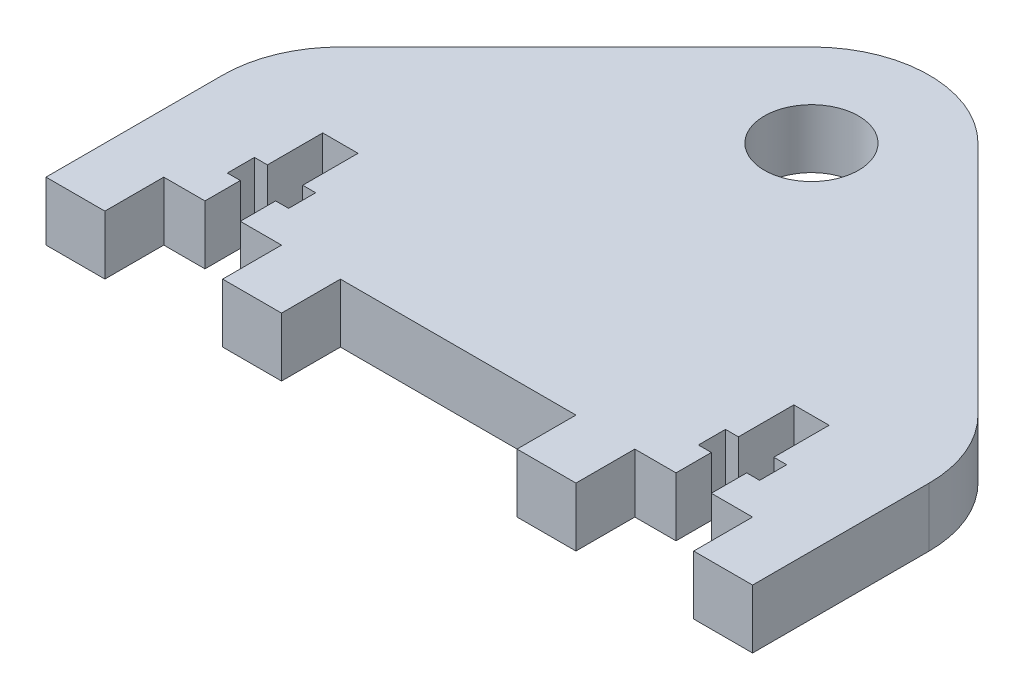
from build123d import *

# Parameters (mm, degrees)
SKETCH1_R           = 4
BOSS_EXTRUDE1_DEPTH = 5


with BuildPart() as part:
    # Sketch1 → Boss-Extrude1 (new body)
    with BuildSketch(Plane(origin=(0, 0, 0), x_dir=(1, 0, 0), z_dir=(0, 1, 0))):
        with BuildLine():
            Line((-30, 10), (-30, -5))
            Line((-30, -5), (-25, -5))
            Line((-25, -5), (-25, 0))
            Line((-25, 0), (-21.5, 0))
            Line((-21.5, 0), (-21.5, 3))
            Line((-21.5, 3), (-22.6, 3))
            Line((-22.6, 3), (-22.6, 5.3))
            Line((-22.6, 5.3), (-21.5, 5.3))
            Line((-21.5, 5.3), (-21.5, 10))
            Line((-21.5, 10), (-18.5, 10))
            Line((-18.5, 10), (-18.5, 5.3))
            Line((-18.5, 5.3), (-17.4, 5.3))
            Line((-17.4, 5.3), (-17.4, 3))
            Line((-17.4, 3), (-18.5, 3))
            Line((-18.5, 3), (-18.5, 0))
            Line((-18.5, 0), (-15, 0))
            Line((-15, 0), (-15, -5))
            Line((-15, -5), (-10, -5))
            Line((-10, -5), (-10, 0))
            Line((-10, 0), (10, 0))
            Line((10, 0), (10, -5))
            Line((10, -5), (15, -5))
            Line((15, -5), (15, 0))
            Line((15, 0), (18.5, 0))
            Line((18.5, 0), (18.5, 3))
            Line((18.5, 3), (17.4, 3))
            Line((17.4, 3), (17.4, 5.3))
            Line((17.4, 5.3), (18.5, 5.3))
            Line((18.5, 5.3), (18.5, 10))
            Line((18.5, 10), (21.5, 10))
            Line((21.5, 10), (21.5, 5.3))
            Line((21.5, 5.3), (22.6, 5.3))
            Line((22.6, 5.3), (22.6, 3))
            Line((22.6, 3), (21.5, 3))
            Line((21.5, 3), (21.5, 0))
            Line((21.5, 0), (25, 0))
            Line((25, 0), (25, -5))
            Line((25, -5), (30, -5))
            Line((30, -5), (30, 10))
            ThreePointArc((30, 10), (29.238795325, 13.826834324), (27.071067812, 17.071067812))
            Line((27.071067812, 17.071067812), (7.071067812, 37.071067812))
            ThreePointArc((7.071067812, 37.071067812), (0, 40), (-7.071067812, 37.071067812))
            Line((-7.071067812, 37.071067812), (-27.071067812, 17.071067812))
            ThreePointArc((-27.071067812, 17.071067812), (-29.238795325, 13.826834324), (-30, 10))
        make_face()
        with Locations((0, 30)):
            Circle(SKETCH1_R, mode=Mode.SUBTRACT)
    extrude(amount=BOSS_EXTRUDE1_DEPTH)


solid = part.part
